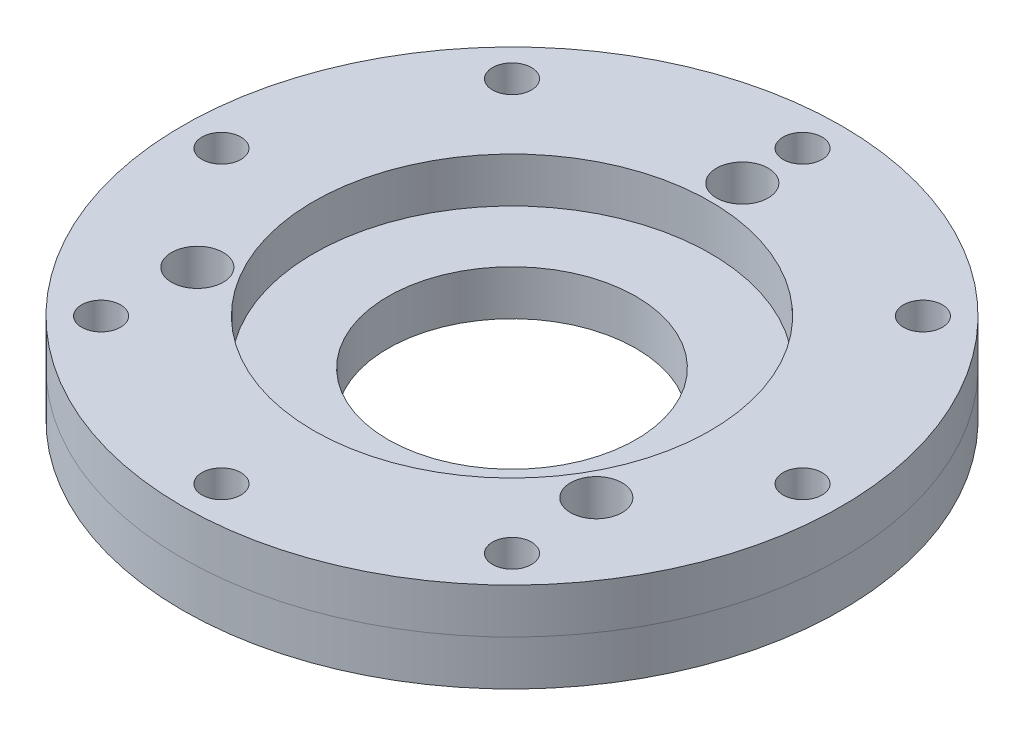
from build123d import *

# Parameters (mm, degrees)
SKETCH1_R           = 46.5
SKETCH1_R_2         = 2.25
SKETCH1_R_3         = 17.5
BOSS_EXTRUDE1_DEPTH = 12.7
SKETCH2_R           = 28
CUT_EXTRUDE1_DEPTH  = 6.35
SKETCH3_R           = 2.75
CUT_EXTRUDE2_DEPTH  = 6.35
SKETCH4_R           = 3.65
CUT_EXTRUDE3_DEPTH  = 6.35
SKETCH5_R           = 2.1
CUT_EXTRUDE4_DEPTH  = 67.976040492


with BuildPart() as part:
    # Sketch1 → Boss-Extrude1 (new body)
    with BuildSketch(Plane(origin=(0, 0, 0), x_dir=(1, 0, 0), z_dir=(0, 1, 0))):
        Circle(SKETCH1_R)
        with Locations((0, 32.5)):
            Circle(SKETCH1_R_2, mode=Mode.SUBTRACT)
        with Locations((28.145825623, -16.25)):
            Circle(SKETCH1_R_2, mode=Mode.SUBTRACT)
        with Locations((-28.145825623, -16.25)):
            Circle(SKETCH1_R_2, mode=Mode.SUBTRACT)
        Circle(SKETCH1_R_3, mode=Mode.SUBTRACT)
    extrude(amount=BOSS_EXTRUDE1_DEPTH)

    # Sketch2 → Cut-Extrude1 (cut)
    with BuildSketch(Plane(origin=(0, 12.7, 0), x_dir=(1, 0, 0), z_dir=(0, 1, 0))):
        Circle(SKETCH2_R)
    extrude(amount=-CUT_EXTRUDE1_DEPTH, mode=Mode.SUBTRACT)

    # Sketch3 → Cut-Extrude2 (cut)
    with BuildSketch(Plane(origin=(0, 12.7, 0), x_dir=(1, 0, 0), z_dir=(0, 1, 0))):
        with Locations((0, 41)):
            Circle(SKETCH3_R)
        with Locations((28.991378029, 28.991378029)):
            Circle(SKETCH3_R)
        with Locations((41, 0)):
            Circle(SKETCH3_R)
        with Locations((28.991378029, -28.991378029)):
            Circle(SKETCH3_R)
        with Locations((0, -41)):
            Circle(SKETCH3_R)
        with Locations((-28.991378029, -28.991378029)):
            Circle(SKETCH3_R)
        with Locations((-41, 0)):
            Circle(SKETCH3_R)
        with Locations((-28.991378029, 28.991378029)):
            Circle(SKETCH3_R)
    extrude(amount=-CUT_EXTRUDE2_DEPTH, mode=Mode.SUBTRACT)

    # Sketch4 → Cut-Extrude3 (cut)
    with BuildSketch(Plane(origin=(0, 12.7, 0), x_dir=(1, 0, 0), z_dir=(0, 1, 0))):
        with Locations((0, 32.5)):
            Circle(SKETCH4_R)
        with Locations((28.145825623, -16.25)):
            Circle(SKETCH4_R)
        with Locations((-28.145825623, -16.25)):
            Circle(SKETCH4_R)
    extrude(amount=-CUT_EXTRUDE3_DEPTH, mode=Mode.SUBTRACT)


with BuildPart() as body_2:
    # Split1: the piece on the far side of the plane
    add(part.part)
    split(bisect_by=Plane.ZX.offset(6.35), keep=Keep.BOTTOM)

    # Sketch5 → Cut-Extrude4 (cut, through all)
    with BuildSketch(Plane(origin=(0, 12.7, 0), x_dir=(1, 0, 0), z_dir=(0, 1, 0))):
        with Locations((0, 41)):
            Circle(SKETCH5_R)
        with Locations((28.991378029, 28.991378029)):
            Circle(SKETCH5_R)
        with Locations((41, 0)):
            Circle(SKETCH5_R)
        with Locations((28.991378029, -28.991378029)):
            Circle(SKETCH5_R)
        with Locations((0, -41)):
            Circle(SKETCH5_R)
        with Locations((-28.991378029, -28.991378029)):
            Circle(SKETCH5_R)
        with Locations((-41, 0)):
            Circle(SKETCH5_R)
        with Locations((-28.991378029, 28.991378029)):
            Circle(SKETCH5_R)
    extrude(amount=-CUT_EXTRUDE4_DEPTH, mode=Mode.SUBTRACT)


with BuildPart() as part_1:
    add(part.part)

    # Split1
    split(bisect_by=Plane.ZX.offset(6.35), keep=Keep.TOP)


solid = Compound([body_2.part, part_1.part])
